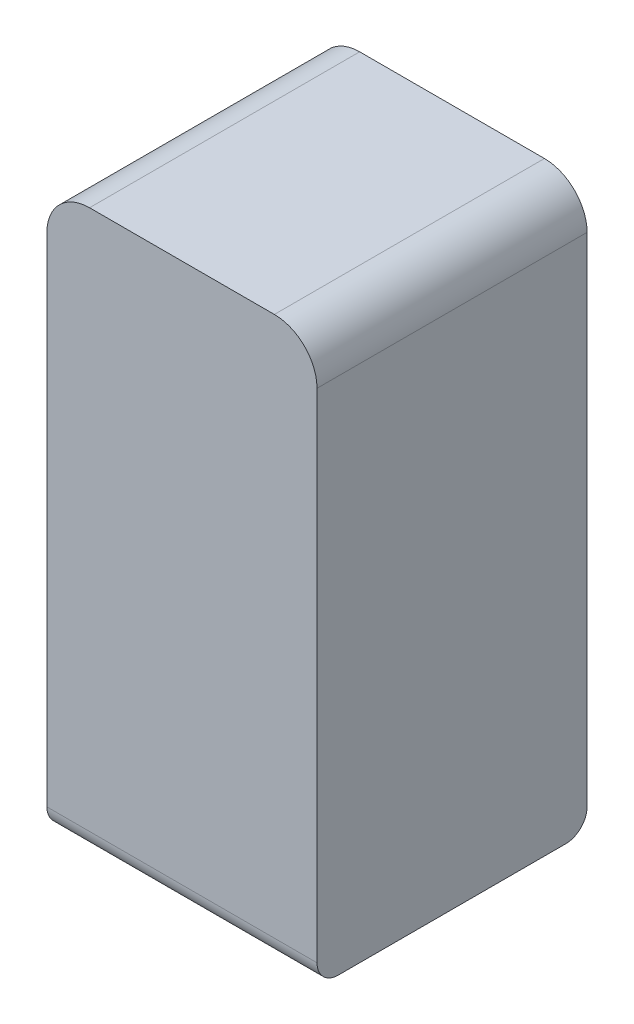
from build123d import *

# Parameters (mm, degrees)
SKETCH1_W           = 38
SKETCH1_H           = 79
BOSS_EXTRUDE1_DEPTH = 38
FILLET1_R           = 6
FILLET2_R           = 3


with BuildPart() as part:
    # Sketch1 → Boss-Extrude1 (new body)
    with BuildSketch(Plane.XY):
        Rectangle(SKETCH1_W, SKETCH1_H)
    extrude(amount=BOSS_EXTRUDE1_DEPTH)

    # Fillet1
    fillet1_edges = [part.edges().sort_by_distance(p)[0] for p in [
        (19, 39.5, 19),
        (-19, 39.5, 19),
    ]]
    fillet(fillet1_edges, radius=FILLET1_R)

    # Fillet2
    fillet2_edges = [part.edges().sort_by_distance(p)[0] for p in [
        (0, -39.5, 38),
        (0, -39.5, 0),
    ]]
    fillet(fillet2_edges, radius=FILLET2_R)


solid = part.part
